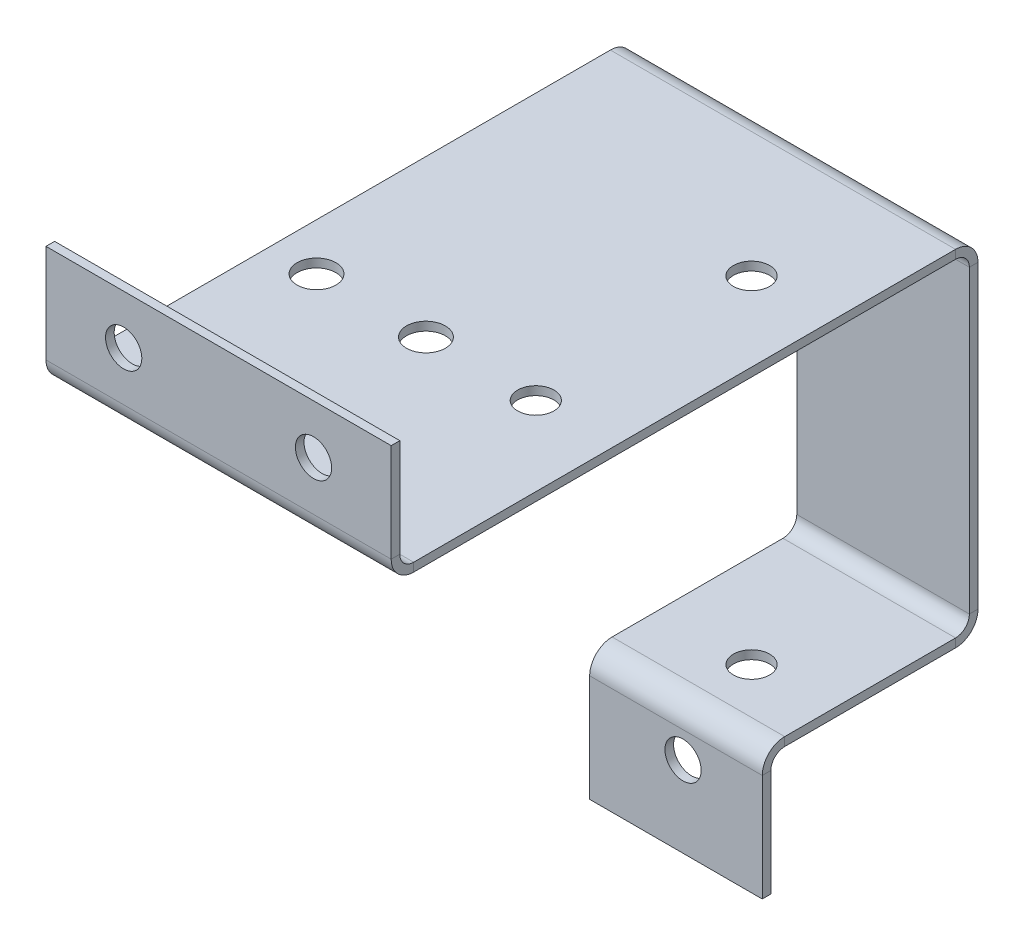
from build123d import *

# Parameters (mm, degrees)
BASE_FLANGE1_DEPTH           = 1
EDGE_FLANGE1_STRIP_W         = 7.2
EDGE_FLANGE1_STRIP_H         = 1
EDGE_FLANGE1_STRIP_CUT_DEPTH = 40
EDGE_FLANGE1_DEPTH           = 40
EDGE_FLANGE2_STRIP_W         = 7.2
EDGE_FLANGE2_STRIP_H         = 1
EDGE_FLANGE2_STRIP_CUT_DEPTH = 40
EDGE_FLANGE2_DEPTH           = 40
EDGE_FLANGE3_STRIP_W         = 7.2
EDGE_FLANGE3_STRIP_H         = 1
EDGE_FLANGE3_STRIP_CUT_DEPTH = 20
EDGE_FLANGE3_DEPTH           = 20
EDGE_FLANGE4_STRIP_W         = 7.2
EDGE_FLANGE4_STRIP_H         = 1
EDGE_FLANGE4_STRIP_CUT_DEPTH = 20
EDGE_FLANGE4_DEPTH           = 20
SKETCH18_R                   = 2.1
CUT_EXTRUDE1_DEPTH           = 6
SKETCH19_R                   = 2.1
CUT_EXTRUDE2_DEPTH           = 6
SKETCH20_R                   = 2.1
CUT_EXTRUDE3_DEPTH           = 50
SKETCH21_R                   = 2.25
CUT_EXTRUDE4_DEPTH           = 50


# Sheet-metal steps are written as plain solids
with BuildPart() as part:
    # Sketch1 → Base-Flange1 (new body)
    with BuildSketch(Plane.XY):
        Polygon((0, 0), (0, 3), (-40, 3), (-40, 0), (-20, 0), (-20, -37), (-18.16511543, -37), (0, -37), align=None)
    extrude(amount=-BASE_FLANGE1_DEPTH)

    # Edge-Flange1 strip (across the edge) → Edge-Flange1 strip cut (cut)
    with BuildSketch(Plane(origin=(0, 3, 0), x_dir=(0, -1, 0), z_dir=(-1, 0, 0))):
        with Locations((-1, -0.5)):
            Rectangle(EDGE_FLANGE1_STRIP_W, EDGE_FLANGE1_STRIP_H)
    extrude(amount=EDGE_FLANGE1_STRIP_CUT_DEPTH, mode=Mode.SUBTRACT)

    # Edge-Flange1 section (across the edge) → Edge-Flange1 (add)
    with BuildSketch(Plane(origin=(0, 3, 0), x_dir=(0, -1, 0), z_dir=(-1, 0, 0))):
        with BuildLine():
            Line((0, 1.6), (0, 67))
            Line((0, 67), (1, 67))
            Line((1, 67), (1, 1.6))
            ThreePointArc((1, 1.6), (1.46862915, 0.46862915), (2.6, 0))
            Line((2.6, 0), (2.6, -1))
            ThreePointArc((2.6, -1), (0.761522369, -0.238477631), (0, 1.6))
        make_face()
    extrude(amount=EDGE_FLANGE1_DEPTH)

    # Edge-Flange2 strip (across the edge) → Edge-Flange2 strip cut (cut)
    with BuildSketch(Plane(origin=(-40, 3, 67), x_dir=(0, 0, -1), z_dir=(1, 0, 0))):
        with Locations((-1, -0.5)):
            Rectangle(EDGE_FLANGE2_STRIP_W, EDGE_FLANGE2_STRIP_H)
    extrude(amount=EDGE_FLANGE2_STRIP_CUT_DEPTH, mode=Mode.SUBTRACT)

    # Edge-Flange2 section (across the edge) → Edge-Flange2 (add)
    with BuildSketch(Plane(origin=(-40, 3, 67), x_dir=(0, 0, -1), z_dir=(1, 0, 0))):
        with BuildLine():
            Line((0, 1.6), (0, 13))
            Line((0, 13), (1, 13))
            Line((1, 13), (1, 1.6))
            ThreePointArc((1, 1.6), (1.46862915, 0.46862915), (2.6, 0))
            Line((2.6, 0), (2.6, -1))
            ThreePointArc((2.6, -1), (0.761522369, -0.238477631), (0, 1.6))
        make_face()
    extrude(amount=EDGE_FLANGE2_DEPTH)

    # Edge-Flange3 strip (across the edge) → Edge-Flange3 strip cut (cut)
    with BuildSketch(Plane(origin=(-20, -37, 0), x_dir=(0, 1, 0), z_dir=(1, 0, 0))):
        with Locations((-1, -0.5)):
            Rectangle(EDGE_FLANGE3_STRIP_W, EDGE_FLANGE3_STRIP_H)
    extrude(amount=EDGE_FLANGE3_STRIP_CUT_DEPTH, mode=Mode.SUBTRACT)

    # Edge-Flange3 section (across the edge) → Edge-Flange3 (add)
    with BuildSketch(Plane(origin=(-20, -37, 0), x_dir=(0, 1, 0), z_dir=(1, 0, 0))):
        with BuildLine():
            Line((0, 1.6), (0, 24))
            Line((0, 24), (1, 24))
            Line((1, 24), (1, 1.6))
            ThreePointArc((1, 1.6), (1.46862915, 0.46862915), (2.6, 0))
            Line((2.6, 0), (2.6, -1))
            ThreePointArc((2.6, -1), (0.761522369, -0.238477631), (0, 1.6))
        make_face()
    extrude(amount=EDGE_FLANGE3_DEPTH)

    # Edge-Flange4 strip (across the edge) → Edge-Flange4 strip cut (cut)
    with BuildSketch(Plane(origin=(0, -37, 24), x_dir=(0, 0, -1), z_dir=(-1, 0, 0))):
        with Locations((-1, -0.5)):
            Rectangle(EDGE_FLANGE4_STRIP_W, EDGE_FLANGE4_STRIP_H)
    extrude(amount=EDGE_FLANGE4_STRIP_CUT_DEPTH, mode=Mode.SUBTRACT)

    # Edge-Flange4 section (across the edge) → Edge-Flange4 (add)
    with BuildSketch(Plane(origin=(0, -37, 24), x_dir=(0, 0, -1), z_dir=(-1, 0, 0))):
        with BuildLine():
            Line((0, 1.6), (0, 14))
            Line((0, 14), (1, 14))
            Line((1, 14), (1, 1.6))
            ThreePointArc((1, 1.6), (1.46862915, 0.46862915), (2.6, 0))
            Line((2.6, 0), (2.6, -1))
            ThreePointArc((2.6, -1), (0.761522369, -0.238477631), (0, 1.6))
        make_face()
    extrude(amount=EDGE_FLANGE4_DEPTH)

    # Sketch18 → Cut-Extrude1 (cut)
    with BuildSketch(Plane(origin=(0, 0, 66), x_dir=(-1, 0, 0), z_dir=(0, 0, -1))):
        with Locations((9, 10.3)):
            Circle(SKETCH18_R)
        with Locations((31, 10.3)):
            Circle(SKETCH18_R)
    extrude(amount=-CUT_EXTRUDE1_DEPTH, mode=Mode.SUBTRACT)

    # Sketch19 → Cut-Extrude2 (cut)
    with BuildSketch(Plane(origin=(0, 0, 23), x_dir=(-1, 0, 0), z_dir=(0, 0, -1))):
        with Locations((9.178318955, -41.637901039)):
            Circle(SKETCH19_R)
    extrude(amount=-CUT_EXTRUDE2_DEPTH, mode=Mode.SUBTRACT)

    # Sketch20 → Cut-Extrude3 (cut)
    with BuildSketch(Plane(origin=(0, 3, 0), x_dir=(1, 0, 0), z_dir=(0, 1, 0))):
        with Locations(Location((-9.153318955, -41.090231637, 0), (0, 0, 270))):
            Circle(SKETCH20_R)
        with Locations(Location((-9.153318955, -16.090231637, 0), (0, 0, 270))):
            Circle(SKETCH20_R)
    extrude(amount=-CUT_EXTRUDE3_DEPTH, mode=Mode.SUBTRACT)

    # Sketch21 → Cut-Extrude4 (cut)
    with BuildSketch(Plane.XZ.offset(-2)):
        with Locations(Location((-21.883318955, 41.090231637, 0), (0, 0, 270))):
            Circle(SKETCH21_R)
        with Locations(Location((-34.563318955, 41.090231637, 0), (0, 0, 270))):
            Circle(SKETCH21_R)
    extrude(amount=-CUT_EXTRUDE4_DEPTH, mode=Mode.SUBTRACT)


solid = part.part
